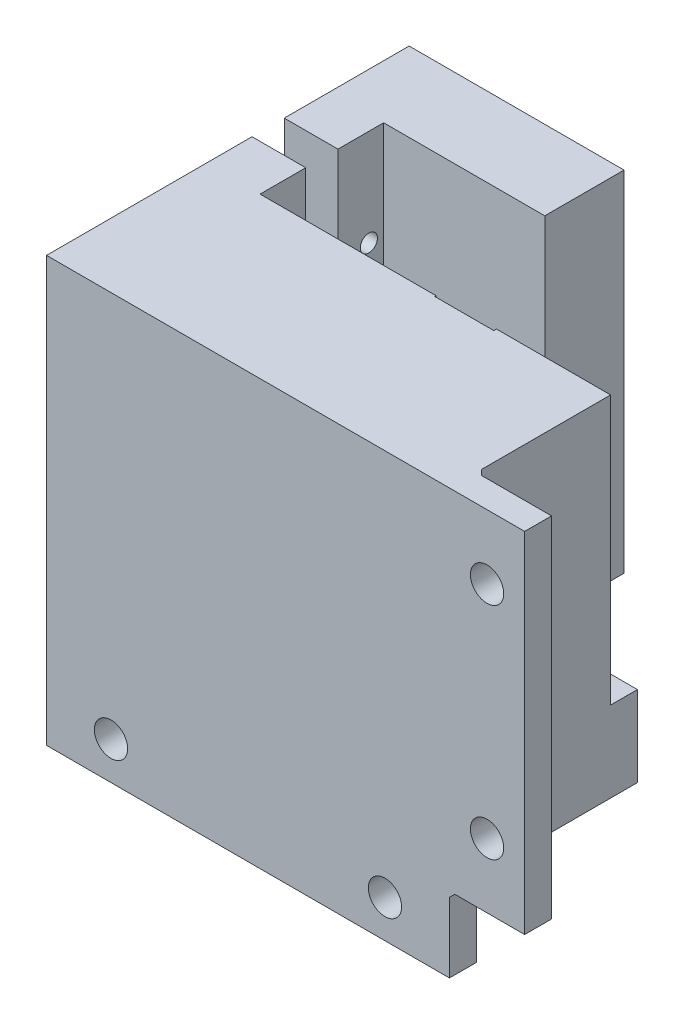
from build123d import *

# Parameters (mm, degrees)
BOSS_EXTRUDE1_DEPTH      = 42.5
BOSS_EXTRUDE1_DEPTH_BACK = 15
SKETCH1_W                = 40
SKETCH1_H                = 65
SKETCH3_W                = 22.5
SKETCH3_H                = 50
CUT_EXTRUDE2_DEPTH       = 30
SKETCH4_R                = 4.5
CUT_EXTRUDE3_DEPTH       = 10
SKETCH5_W                = 35
SKETCH5_H                = 25
BOSS_EXTRUDE3_DEPTH      = 15
SKETCH6_R                = 3
CUT_EXTRUDE4_DEPTH       = 15
CUT_EXTRUDE5_DEPTH       = 108.964114408
BOSS_EXTRUDE4_DEPTH      = 10
BOSS_EXTRUDE5_OUTLINE_R  = 3
BOSS_EXTRUDE5_DEPTH      = 50
BOSS_EXTRUDE6_START      = -50
SKETCH11_R               = 3
BOSS_EXTRUDE6_DEPTH      = 50
SKETCH12_W               = 14
SKETCH12_H               = 65
SKETCH12_R               = 3.1
SKETCH12_W_2             = 75
SKETCH12_H_2             = 14
BOSS_EXTRUDE7_DEPTH      = 5
SKETCH13_R               = 1.6
CUT_EXTRUDE6_DEPTH       = 115.988042857
CUT_EXTRUDE7_DEPTH       = 11.5
CUT_EXTRUDE7_DEPTH_BACK  = 11.5
SKETCH14_W               = 43.75
SKETCH14_H               = 50
CUT_EXTRUDE8_DEPTH       = 30
CUT_EXTRUDE9_DEPTH       = 115.988042857
CUT_EXTRUDE10_DEPTH      = 18
SKETCH18_W               = 31
SKETCH18_H               = 12
SKETCH18_R               = 2.1
BOSS_EXTRUDE8_DEPTH      = 5
FILLET2_R                = 1
SKETCH19_W               = 9.25
SKETCH19_H               = 10
CUT_EXTRUDE11_DEPTH      = 10
CHAMFER1_SIZE            = 1
CHAMFER2_SIZE            = 1


# Read off the part's stored shape, not the designer's step: Boss-Extrude5
# Some blends are built 0.0001 mm under size
with BuildPart() as part:
    # Sketch1 → Boss-Extrude1 (new, two sides: drawn at the far end of the back side and taken through both)
    with BuildSketch(Plane.XY.offset(-BOSS_EXTRUDE1_DEPTH_BACK)):
        with Locations((20, 32.5)):
            Rectangle(SKETCH1_W, SKETCH1_H)
    extrude(amount=BOSS_EXTRUDE1_DEPTH + BOSS_EXTRUDE1_DEPTH_BACK)

    # Sketch3 → Cut-Extrude2 (cut)
    with BuildSketch(Plane(origin=(40, 0, 0), x_dir=(0, 0, -1), z_dir=(1, 0, 0))):
        with Locations((-11.25, 40)):
            Rectangle(SKETCH3_W, SKETCH3_H)
    extrude(amount=-CUT_EXTRUDE2_DEPTH, mode=Mode.SUBTRACT)

    # Sketch4 → Cut-Extrude3 (cut)
    with BuildSketch(Plane(origin=(10, 0, 0), x_dir=(0, 0, -1), z_dir=(1, 0, 0))):
        with Locations((-11.25, 26.5)):
            Circle(SKETCH4_R)
    extrude(amount=-CUT_EXTRUDE3_DEPTH, mode=Mode.SUBTRACT)

    # Sketch5 → Boss-Extrude3 (add)
    with BuildSketch(Plane.XZ):
        with Locations((57.5, 30)):
            Rectangle(SKETCH5_W, SKETCH5_H)
    extrude(amount=-BOSS_EXTRUDE3_DEPTH)

    # Sketch6 → Cut-Extrude4 (cut)
    with BuildSketch(Plane.XZ):
        with Locations(Location((32, 29.5, 0), (0, 0, 270))):
            Circle(SKETCH6_R)
        with Locations(Location((64, 29.5, 0), (0, 0, 270))):
            Circle(SKETCH6_R)
    extrude(amount=-CUT_EXTRUDE4_DEPTH, mode=Mode.SUBTRACT)

    # Sketch8 → Cut-Extrude5 (cut, through all)
    with BuildSketch(Plane.XZ):
        Polygon((48.25, 17.5), (42.75, 17.5), (42.75, 23), (53.75, 23), (53.75, 17.5), align=None)
    extrude(amount=-CUT_EXTRUDE5_DEPTH, mode=Mode.SUBTRACT)

    # Sketch9 → Boss-Extrude4 (add)
    with BuildSketch(Plane.XY.offset(42.5)):
        Polygon((0, 65), (0, 0), (75, 0), (75, 15), (40, 15), (40, 65), align=None)
    extrude(amount=BOSS_EXTRUDE4_DEPTH)

    # Boss-Extrude5 outline → Boss-Extrude5 (add)
    with BuildSketch(Plane(origin=(0, 15, 0), x_dir=(1, 0, 0), z_dir=(0, 1, 0))):
        Polygon((75, -52.5), (75, -22.5), (53.75, -22.5), (53.75, -23), (42.75, -23), (42.75, -22.5), (40, -22.5), (40, -52.5), align=None)
        with Locations((64, -29.5)):
            Circle(BOSS_EXTRUDE5_OUTLINE_R, mode=Mode.SUBTRACT)
    extrude(amount=BOSS_EXTRUDE5_DEPTH)

    # Sketch11 → Boss-Extrude6 (add)
    with BuildSketch(Plane(origin=(0, 65, 0), x_dir=(1, 0, 0), z_dir=(0, 1, 0)).offset(BOSS_EXTRUDE6_START)):
        with Locations(Location((64, -29.5, 0), (0, 0, 90))):
            Circle(SKETCH11_R)
    extrude(amount=BOSS_EXTRUDE6_DEPTH)

    # Sketch12 → Boss-Extrude7 (add)
    # profile 1 of 2: a face of its own
    with BuildSketch(Plane.XY.offset(52.5)):
        with Locations((82, 32.5)):
            Rectangle(SKETCH12_W, SKETCH12_H)
        with Locations((82, 53)):
            Circle(SKETCH12_R, mode=Mode.SUBTRACT)
        with Locations((82, 12)):
            Circle(SKETCH12_R, mode=Mode.SUBTRACT)
    # profile 2 of 2: a face of its own
    with BuildSketch(Plane.XY.offset(52.5)):
        with Locations((37.5, -7)):
            Rectangle(SKETCH12_W_2, SKETCH12_H_2)
        with Locations((12, -7)):
            Circle(SKETCH12_R, mode=Mode.SUBTRACT)
        with Locations((63, -7)):
            Circle(SKETCH12_R, mode=Mode.SUBTRACT)
    extrude(amount=-BOSS_EXTRUDE7_DEPTH)

    # Sketch13 → Cut-Extrude6 (cut, through all)
    with BuildSketch(Plane(origin=(10, 0, 0), x_dir=(0, 0, -1), z_dir=(1, 0, 0))):
        with Locations((-2.5, 47)):
            Circle(SKETCH13_R)
        with Locations((-20, 47)):
            Circle(SKETCH13_R)
    extrude(amount=-CUT_EXTRUDE6_DEPTH, mode=Mode.SUBTRACT)

    # Sketch14 → Cut-Extrude7 (cut, two sides: drawn at the far end of the back side and taken through both)
    with BuildSketch(Plane(origin=(0, 0, 11.25), x_dir=(-1, 0, 0), z_dir=(0, 0, -1)).offset(-CUT_EXTRUDE7_DEPTH_BACK)):
        with Locations((-31.875, 40)):
            Rectangle(SKETCH14_W, SKETCH14_H)
    extrude(amount=CUT_EXTRUDE7_DEPTH + CUT_EXTRUDE7_DEPTH_BACK, mode=Mode.SUBTRACT)

    # Sketch15 → Cut-Extrude8 (cut)
    with BuildSketch(Plane(origin=(40, 0, 0), x_dir=(0, 0, -1), z_dir=(1, 0, 0))):
        Polygon((-11.25, 15), (-8.25, 15), (-8.25, 9), (-14.25, 9), (-14.25, 15), align=None)
    extrude(amount=-CUT_EXTRUDE8_DEPTH, mode=Mode.SUBTRACT)

    # Sketch16 → Cut-Extrude9 (cut, through all)
    with BuildSketch(Plane(origin=(10, 0, 0), x_dir=(0, 0, -1), z_dir=(1, 0, 0))):
        Polygon((-11.25, 65), (-8.25, 65), (-8.25, 50), (-14.25, 50), (-14.25, 65), align=None)
    extrude(amount=-CUT_EXTRUDE9_DEPTH, mode=Mode.SUBTRACT)

    # Sketch17 → Cut-Extrude10 (cut)
    with BuildSketch(Plane.ZY):
        with BuildLine():
            Line((28.25, 26.5), (28.25, 0))
            Line((28.25, 0), (-5.75, 0))
            Line((-5.75, 0), (-5.75, 26.5))
            ThreePointArc((-5.75, 26.5), (11.25, 43.5), (28.25, 26.5))
        make_face()
    extrude(amount=-CUT_EXTRUDE10_DEPTH, mode=Mode.SUBTRACT)

    # Sketch18 → Boss-Extrude8 (add)
    # profile 1 of 3: a face of its own
    with BuildSketch(Plane(origin=(78.326188017, 6.6, -27.619079409), x_dir=(-1, 0, 0), z_dir=(0, -1, 0))):
        Polygon((60.326188017, -28.604062705), (60.326188017, -33.604062705), (65.326188017, -33.604062705), align=None)
    # profile 2 of 3: a face of its own
    with BuildSketch(Plane(origin=(78.326188017, 6.6, -27.619079409), x_dir=(-1, 0, 0), z_dir=(0, -1, 0))):
        Polygon((65.326188017, -45.604062705), (60.326188017, -45.604062705), (60.326188017, -50.604062705), align=None)
    # profile 3 of 3: a face of its own
    with BuildSketch(Plane(origin=(78.326188017, 6.6, -27.619079409), x_dir=(-1, 0, 0), z_dir=(0, -1, 0))):
        with Locations((75.826188017, -39.604062705)):
            Rectangle(SKETCH18_W, SKETCH18_H)
        with Locations(Location((85.648688017, -38.869079409, 0), (0, 0, 90))):
            Circle(SKETCH18_R, mode=Mode.SUBTRACT)
        with Locations(Location((65.828688017, -38.869079409, 0), (0, 0, 90))):
            Circle(SKETCH18_R, mode=Mode.SUBTRACT)
    extrude(amount=BOSS_EXTRUDE8_DEPTH)

    # Fillet2
    fillet2_edges = [part.edges().sort_by_distance(p)[0] for p in [
        (0, 43.5, 11.25),
        (0, 13.25, -5.75),
        (0, 13.25, 28.25),
    ]]
    fillet(fillet2_edges, radius=FILLET2_R)

    # Sketch19 → Cut-Extrude11 (cut)
    with BuildSketch(Plane.ZY):
        with Locations((-10.375, 5)):
            Rectangle(SKETCH19_W, SKETCH19_H)
    extrude(amount=-CUT_EXTRUDE11_DEPTH, mode=Mode.SUBTRACT)

    # Chamfer1
    # the kernel refuses this chamfer: 1 mm, written as the material it adds along each edge
    with BuildSketch(Plane(origin=(75, 0, 47.5), x_dir=(-0.027495876610582105, 0, -0.999621916911297), z_dir=(0, 1, 0))) as chamfer1_piece_1:
        Polygon((CHAMFER1_SIZE * 0.999621916911, -CHAMFER1_SIZE * 0.0274958766106), (-CHAMFER1_SIZE * 0.0274958766106, -CHAMFER1_SIZE * 0.999621916911), (0, 0), align=None)
    extrude(amount=65)

    # Chamfer2
    chamfer2_edges = [part.edges().sort_by_distance(p)[0] for p in [
        (37.5, 0, 47.5),
    ]]
    chamfer(chamfer2_edges, length=CHAMFER2_SIZE - 0.0001)  # a hair under: the kernel refuses the full size

    # Chamfer3
    # the kernel refuses this chamfer: 1 mm, written as the material it adds along each edge
    with BuildSketch(Plane(origin=(75, 0, 52.5), x_dir=(0.9996219169112968, 0.02749587661058591, 0), z_dir=(0, 0, -1))) as chamfer3_piece_1_section:
        with BuildLine():
            Line((1.028673195, 0), (-0.056547155, 1.027117794))
            Line((-0.056547155, 1.027117794), (-0.076539593, 1.026567876))
            ThreePointArc((-0.076539593, 1.026567876), (-0.034129227, 0.51339783), (-0.019992438, -0.000549918))
            Line((-0.019992438, -0.000549918), (0.000549918, -0.019992438))
            ThreePointArc((0.000549918, -0.019992438), (0.514497665, -0.00585565), (1.029223113, -0.019992438))
            Line((1.029223113, -0.019992438), (1.028673195, 0))
        make_face()
    chamfer3_piece_1 = extrude(amount=8.571582988, mode=Mode.PRIVATE)
    chamfer3_piece_1 = split(chamfer3_piece_1, bisect_by=Plane(origin=(75.329792283, -0.329792248, 47.5), z_dir=(0, 0, 1)), keep=Keep.TOP, mode=Mode.PRIVATE)
    add(chamfer3_piece_1)
    with BuildSketch(Plane(origin=(75, 0, 52.5), x_dir=(0.9996219169112968, 0.02749587661058591, 0), z_dir=(0, 0, -1))) as chamfer3_piece_2_section:
        with BuildLine():
            Line((1.028673195, 0), (-0.056547155, 1.027117794))
            Line((-0.056547155, 1.027117794), (-0.076539593, 1.026567876))
            ThreePointArc((-0.076539593, 1.026567876), (-0.034129227, 0.51339783), (-0.019992438, -0.000549918))
            Line((-0.019992438, -0.000549918), (0.000549918, -0.019992438))
            ThreePointArc((0.000549918, -0.019992438), (0.514497665, -0.00585565), (1.029223113, -0.019992438))
            Line((1.029223113, -0.019992438), (1.028673195, 0))
        make_face()
    chamfer3_piece_2 = extrude(amount=8.571582988, mode=Mode.PRIVATE)
    chamfer3_piece_2 = split(chamfer3_piece_2, bisect_by=Plane(origin=(74.967608751, -1.017389606, 47.5), z_dir=(0, 0, 1)), keep=Keep.TOP, mode=Mode.PRIVATE)
    chamfer3_piece_2 = split(chamfer3_piece_2, bisect_by=Plane(origin=(74.967608751, -1.013017205, 47.513117205), z_dir=(0, -0.7071067811865464, -0.7071067811865488)), keep=Keep.TOP, mode=Mode.PRIVATE)
    add(chamfer3_piece_2)
    with BuildSketch(Plane(origin=(75, 0, 52.5), x_dir=(0.9996219169112968, 0.02749587661058591, 0), z_dir=(0, 0, -1))) as chamfer3_piece_3_section:
        with BuildLine():
            Line((1.028673195, 0), (-0.056547155, 1.027117794))
            Line((-0.056547155, 1.027117794), (-0.076539593, 1.026567876))
            ThreePointArc((-0.076539593, 1.026567876), (-0.034129227, 0.51339783), (-0.019992438, -0.000549918))
            Line((-0.019992438, -0.000549918), (0.000549918, -0.019992438))
            ThreePointArc((0.000549918, -0.019992438), (0.514497665, -0.00585565), (1.029223113, -0.019992438))
            Line((1.029223113, -0.019992438), (1.028673195, 0))
        make_face()
    chamfer3_piece_3 = extrude(amount=8.571582988, mode=Mode.PRIVATE)
    chamfer3_piece_3 = split(chamfer3_piece_3, bisect_by=Plane(origin=(75.495112372, -0.283467256, 46.995112372), z_dir=(-0.7071067811862649, 0, 0.7071067811868302)), keep=Keep.TOP, mode=Mode.PRIVATE)
    chamfer3_piece_3 = split(chamfer3_piece_3, bisect_by=Plane(origin=(75.283503511, -0.283467256, 47.5), z_dir=(0, 0, -1)), keep=Keep.TOP, mode=Mode.PRIVATE)
    chamfer3_piece_3 = split(chamfer3_piece_3, bisect_by=Plane(origin=(75.283503511, -0.495044244, 46.995144244), z_dir=(0, 0.7071067811865464, 0.7071067811865488)), keep=Keep.TOP, mode=Mode.PRIVATE)
    add(chamfer3_piece_3)
    with BuildSketch(Plane(origin=(75, 0, 52.5), x_dir=(0.9996219169112968, 0.02749587661058591, 0), z_dir=(0, 0, -1))) as chamfer3_piece_4_section:
        with BuildLine():
            Line((1.028673195, 0), (-0.056547155, 1.027117794))
            Line((-0.056547155, 1.027117794), (-0.076539593, 1.026567876))
            ThreePointArc((-0.076539593, 1.026567876), (-0.034129227, 0.51339783), (-0.019992438, -0.000549918))
            Line((-0.019992438, -0.000549918), (0.000549918, -0.019992438))
            ThreePointArc((0.000549918, -0.019992438), (0.514497665, -0.00585565), (1.029223113, -0.019992438))
            Line((1.029223113, -0.019992438), (1.028673195, 0))
        make_face()
    chamfer3_piece_4 = extrude(amount=8.571582988, mode=Mode.PRIVATE)
    chamfer3_piece_4 = split(chamfer3_piece_4, bisect_by=Plane(origin=(76.01307363, 0.032413897, 47.51307363), z_dir=(0.7071067811862649, 0, -0.7071067811868302)), keep=Keep.TOP, mode=Mode.PRIVATE)
    chamfer3_piece_4 = split(chamfer3_piece_4, bisect_by=Plane(origin=(76.017431506, 0.032413897, 47.5), z_dir=(0, 0, 1)), keep=Keep.TOP, mode=Mode.PRIVATE)
    add(chamfer3_piece_4)


solid = part.part
